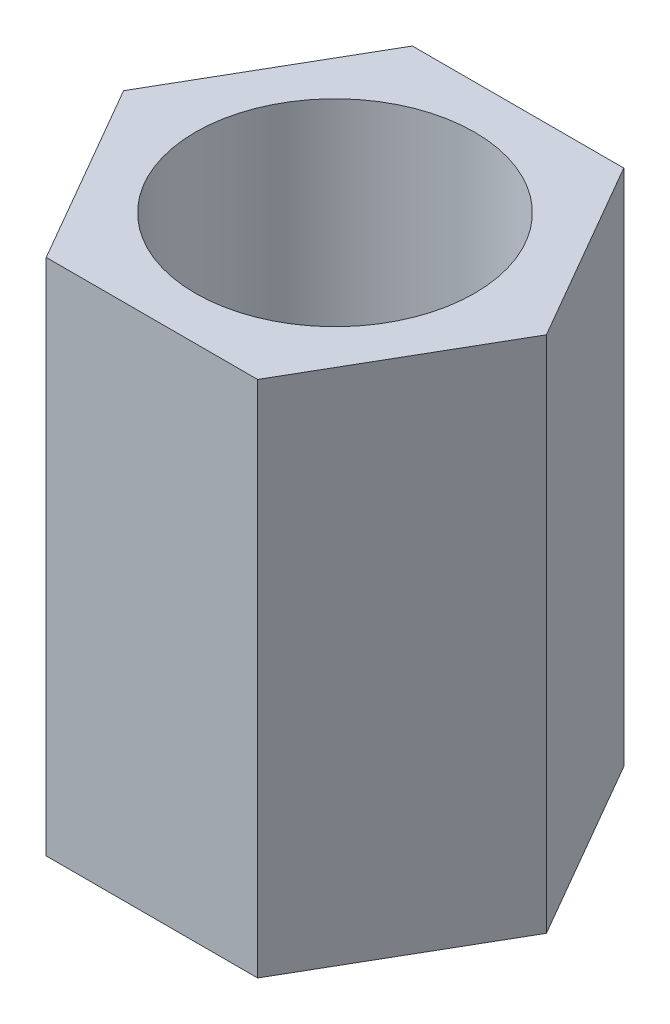
from build123d import *

# Parameters (mm, degrees)
SKETCH1_R           = 4.1
BOSS_EXTRUDE1_DEPTH = 22.65
SKETCH2_R           = 6.1
CUT_EXTRUDE1_DEPTH  = 20


with BuildPart() as part:
    # Sketch1 → Boss-Extrude1 (new body)
    with BuildSketch(Plane(origin=(0, 0, 0), x_dir=(1, 0, 0), z_dir=(0, 1, 0))):
        Polygon((9.237604307, 0), (4.618802154, 8), (-4.618802154, 8), (-9.237604307, 0), (-4.618802154, -8), (4.618802154, -8), align=None)
        Circle(SKETCH1_R, mode=Mode.SUBTRACT)
    extrude(amount=BOSS_EXTRUDE1_DEPTH)

    # Sketch2 → Cut-Extrude1 (cut)
    with BuildSketch(Plane(origin=(0, 22.65, 0), x_dir=(1, 0, 0), z_dir=(0, 1, 0))):
        Circle(SKETCH2_R)
    extrude(amount=-CUT_EXTRUDE1_DEPTH, mode=Mode.SUBTRACT)


solid = part.part
